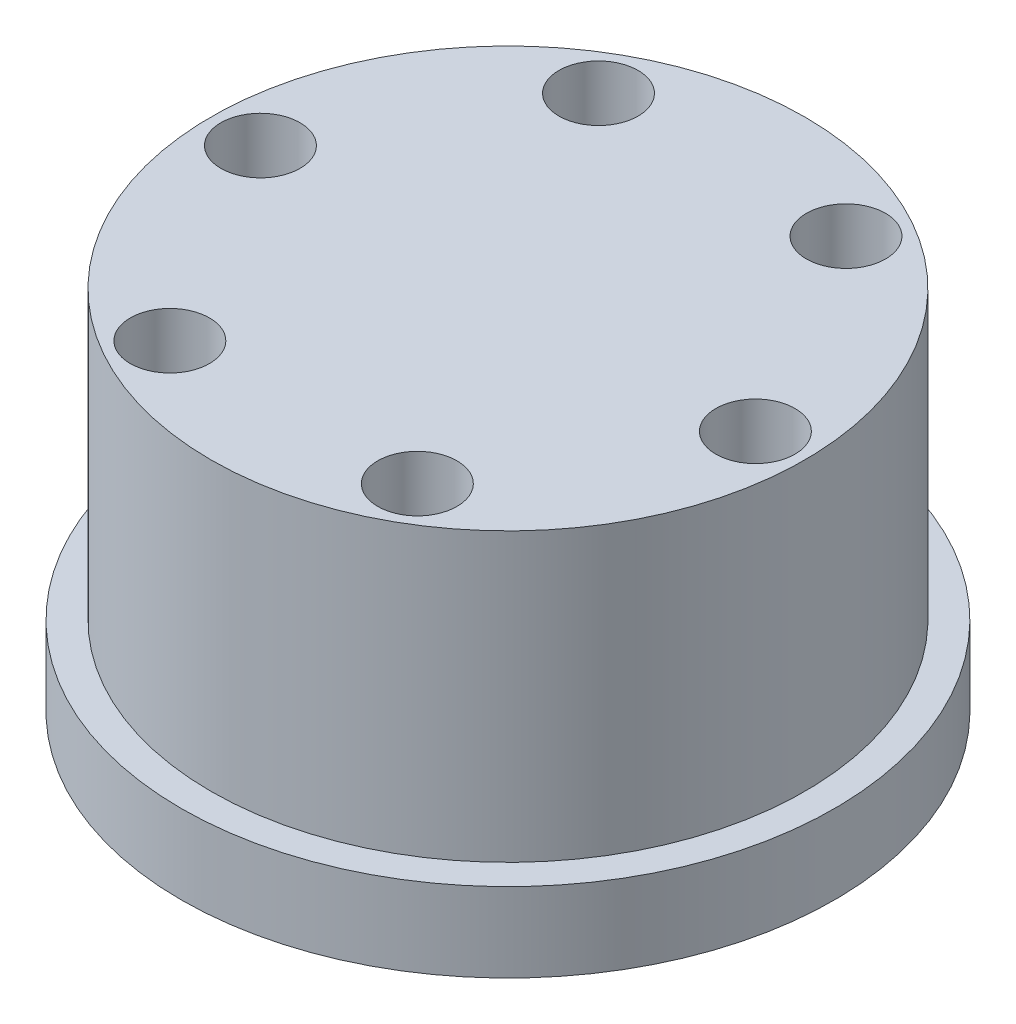
from build123d import *

# Parameters (mm, degrees)
SKETCH1_R           = 16.5
SKETCH1_R_2         = 1.5
BOSS_EXTRUDE1_DEPTH = 4
SKETCH2_R           = 15
BOSS_EXTRUDE2_DEPTH = 14.5
SKETCH5_R           = 2
CUT_EXTRUDE3_DEPTH  = 6.5
SKETCH6_R           = 7.5
CUT_EXTRUDE4_DEPTH  = 4


with BuildPart() as part:
    # Sketch1 → Boss-Extrude1 (new body)
    with BuildSketch(Plane(origin=(0, 0, 0), x_dir=(1, 0, 0), z_dir=(0, 1, 0))):
        Circle(SKETCH1_R)
        with Locations((0, 12.5)):
            Circle(SKETCH1_R_2, mode=Mode.SUBTRACT)
        with Locations((10.825317547, 6.25)):
            Circle(SKETCH1_R_2, mode=Mode.SUBTRACT)
        with Locations((10.825317547, -6.25)):
            Circle(SKETCH1_R_2, mode=Mode.SUBTRACT)
        with Locations((0, -12.5)):
            Circle(SKETCH1_R_2, mode=Mode.SUBTRACT)
        with Locations((-10.825317547, -6.25)):
            Circle(SKETCH1_R_2, mode=Mode.SUBTRACT)
        with Locations((-10.825317547, 6.25)):
            Circle(SKETCH1_R_2, mode=Mode.SUBTRACT)
    extrude(amount=BOSS_EXTRUDE1_DEPTH)

    # Sketch2 → Boss-Extrude2 (add)
    with BuildSketch(Plane(origin=(0, 4, 0), x_dir=(1, 0, 0), z_dir=(0, 1, 0))):
        Circle(SKETCH2_R)
    extrude(amount=BOSS_EXTRUDE2_DEPTH)

    # Sketch5 → Cut-Extrude3 (cut)
    with BuildSketch(Plane(origin=(0, 18.5, 0), x_dir=(1, 0, 0), z_dir=(0, 1, 0))):
        with Locations((-12.5, 0)):
            Circle(SKETCH5_R)
        with Locations((-6.25, 10.825317547)):
            Circle(SKETCH5_R)
        with Locations((6.25, 10.825317547)):
            Circle(SKETCH5_R)
        with Locations((12.5, 0)):
            Circle(SKETCH5_R)
        with Locations((6.25, -10.825317547)):
            Circle(SKETCH5_R)
        with Locations((-6.25, -10.825317547)):
            Circle(SKETCH5_R)
    extrude(amount=-CUT_EXTRUDE3_DEPTH, mode=Mode.SUBTRACT)

    # Sketch6 → Cut-Extrude4 (cut)
    with BuildSketch(Plane.XZ):
        Circle(SKETCH6_R)
    extrude(amount=-CUT_EXTRUDE4_DEPTH, mode=Mode.SUBTRACT)


solid = part.part
